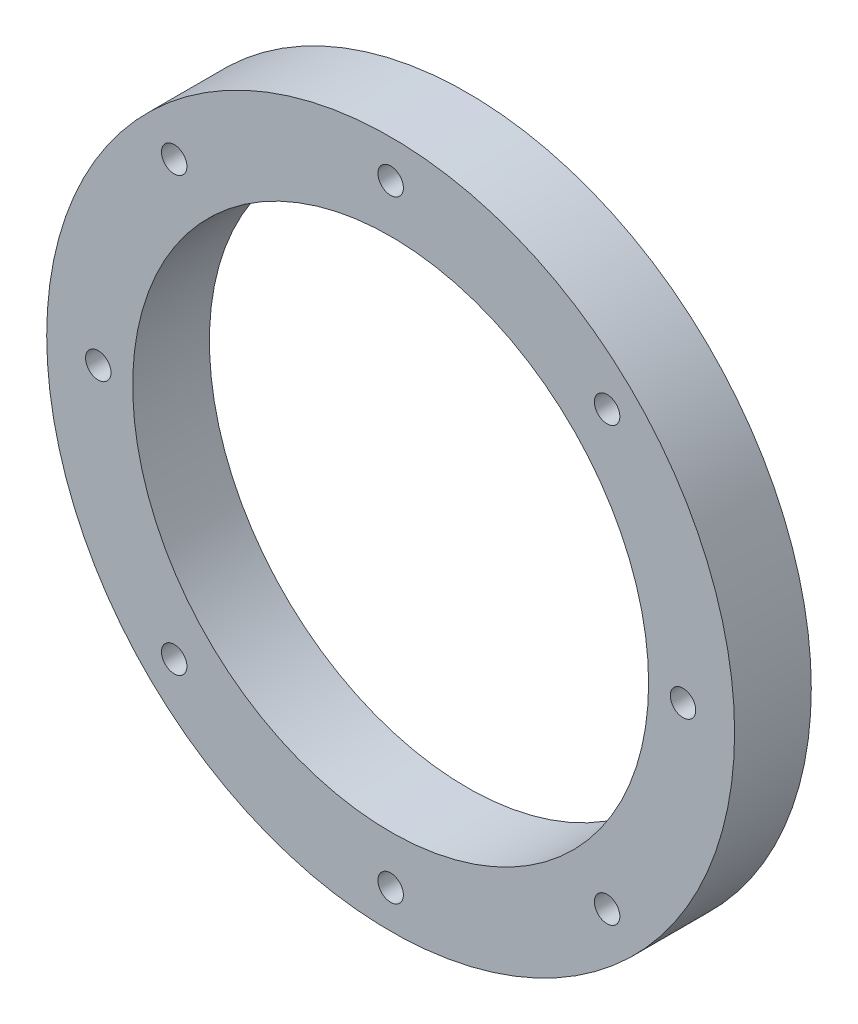
from build123d import *

# Parameters (mm, degrees)
SKETCH_1_R      = 50
SKETCH_1_R_2    = 1.85
SKETCH_1_R_3    = 37.5
EXTRUDE_1_DEPTH = 11.15


with BuildPart() as part:
    # 草图1 → 凸台-拉伸1 (new body)
    with BuildSketch(Plane.XY):
        Circle(SKETCH_1_R)
        with Locations((-31.466251763, -31.466251763)):
            Circle(SKETCH_1_R_2, mode=Mode.SUBTRACT)
        with Locations((-42.5, 0)):
            Circle(SKETCH_1_R_2, mode=Mode.SUBTRACT)
        with Locations((0, -44.5)):
            Circle(SKETCH_1_R_2, mode=Mode.SUBTRACT)
        with Locations((31.466251763, -31.466251763)):
            Circle(SKETCH_1_R_2, mode=Mode.SUBTRACT)
        with Locations((-31.466251763, 31.466251763)):
            Circle(SKETCH_1_R_2, mode=Mode.SUBTRACT)
        Circle(SKETCH_1_R_3, mode=Mode.SUBTRACT)
        with Locations((42.5, 0)):
            Circle(SKETCH_1_R_2, mode=Mode.SUBTRACT)
        with Locations((0, 44.5)):
            Circle(SKETCH_1_R_2, mode=Mode.SUBTRACT)
        with Locations((31.466251763, 31.466251763)):
            Circle(SKETCH_1_R_2, mode=Mode.SUBTRACT)
    extrude(amount=EXTRUDE_1_DEPTH)


solid = part.part
